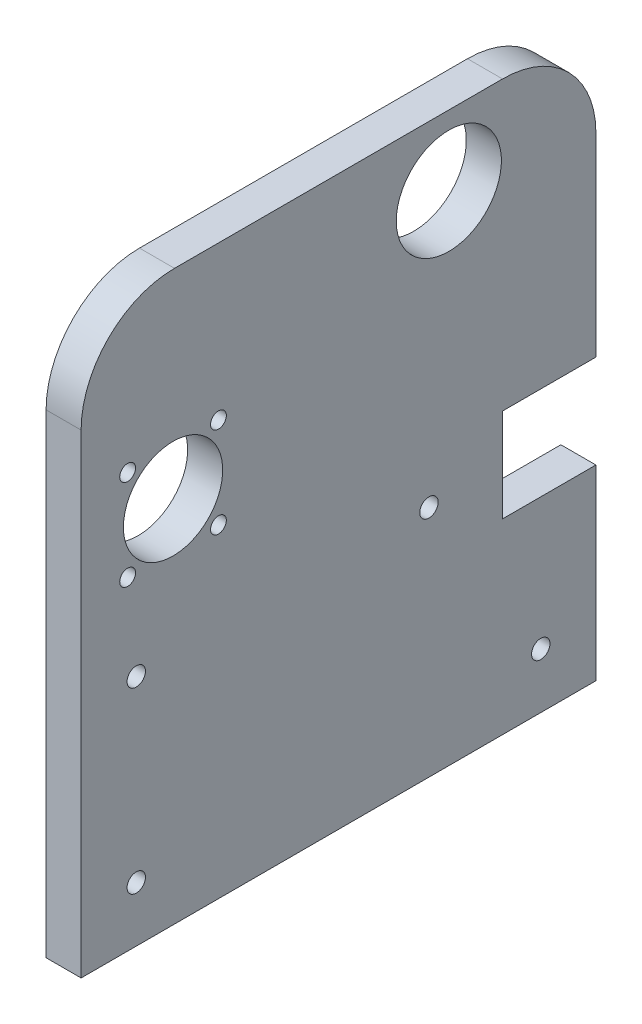
from build123d import *

# Parameters (mm, degrees)
SKETCH1_W             = 9.525
SKETCH1_H             = 140
BOSS_EXTRUDE1_DEPTH   = 77.221817616
FILLET1_R             = 25.4
SKETCH3_R             = 14.29
SKETCH3_R_2           = 2.15
SKETCH3_R_3           = 13.5
CUT_EXTRUDE2_DEPTH    = 28.575
SKETCH5_W             = 25.4
SKETCH5_H             = 25.4
CUT_EXTRUDE4_DEPTH    = 105.661046913
M6_TAPPED_HOLE1_D     = 5
M6_TAPPED_HOLE1_DEPTH = 10
M6_TAPPED_HOLE1_TIP   = 1.502151548
M6_TAPPED_HOLE2_D     = 5


with BuildPart() as part:
    # Sketch1 → Boss-Extrude1 (new, symmetric)
    with BuildSketch(Plane(origin=(0, 0, 0), x_dir=(1, 0, 0), z_dir=(0, 1, 0))):
        Rectangle(SKETCH1_W, SKETCH1_H)
    extrude(amount=BOSS_EXTRUDE1_DEPTH, both=True)

    # Fillet1
    fillet1_edges = [part.edges().sort_by_distance(p)[0] for p in [
        (0, 77.221817616, 70),
        (0, 77.221817616, -70),
    ]]
    fillet(fillet1_edges, radius=FILLET1_R)

    # Sketch3 → Cut-Extrude2 (cut)
    with BuildSketch(Plane.ZY.offset(4.7625)):
        with Locations((-30, 58.171817616)):
            Circle(SKETCH3_R)
        with Locations((32.652147834, 35.519669782)):
            Circle(SKETCH3_R_2)
        with Locations((57.347852166, 35.519669782)):
            Circle(SKETCH3_R_2)
        with Locations((32.652147834, 10.82396545)):
            Circle(SKETCH3_R_2)
        with Locations((57.347852166, 10.82396545)):
            Circle(SKETCH3_R_2)
        with Locations((45, 23.171817616)):
            Circle(SKETCH3_R_3)
    extrude(amount=-CUT_EXTRUDE2_DEPTH, mode=Mode.SUBTRACT)

    # Sketch5 → Cut-Extrude4 (cut, through all)
    with BuildSketch(Plane.ZY.offset(4.7625)):
        with Locations((-57.3, -13.696417616)):
            Rectangle(SKETCH5_W, SKETCH5_H)
    extrude(amount=-CUT_EXTRUDE4_DEPTH, mode=Mode.SUBTRACT)

    # M6 Tapped Hole1
    with Locations(Plane(origin=(0, 0, -44.6), x_dir=(-1, 0, 0), z_dir=(0, 0, -1))):
        with Locations((0, -13.696417616)):
            Hole(M6_TAPPED_HOLE1_D / 2, depth=M6_TAPPED_HOLE1_DEPTH)
            with Locations((0, 0, -(M6_TAPPED_HOLE1_DEPTH + M6_TAPPED_HOLE1_TIP / 2))):  # 118° drill point
                Cone(0, M6_TAPPED_HOLE1_D / 2, M6_TAPPED_HOLE1_TIP, mode=Mode.SUBTRACT)

    # M6 Tapped Hole2 (through all)
    with Locations(Plane.ZY.offset(4.7625)):
        with Locations((-24.6, -13.696417616), (55, -13.696417616), (-55, -62.221817616), (55, -62.221817616)):
            Hole(M6_TAPPED_HOLE2_D / 2)


solid = part.part
